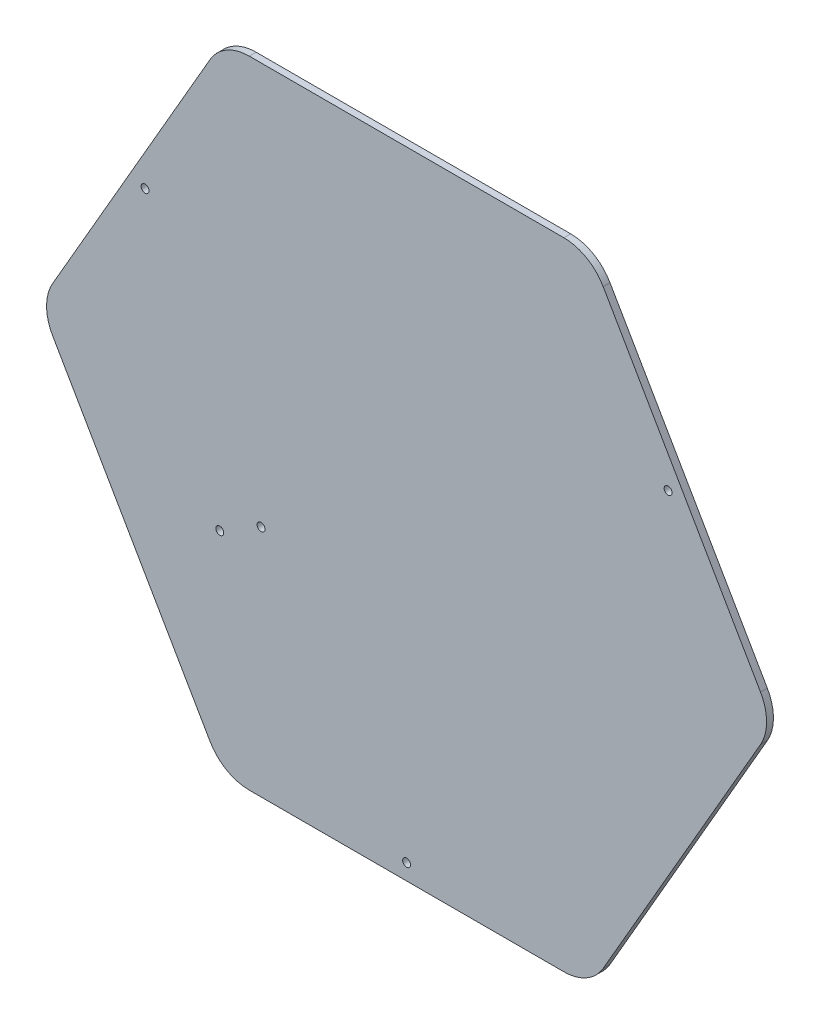
from build123d import *

# Parameters (mm, degrees)
SALIENTE_EXTRUIR1_DEPTH = 3
REDONDEO1_R             = 20
CROQUIS2_R              = 1.75
CORTAR_EXTRUIR1_DEPTH   = 212.545651301
CROQUIS3_R              = 1.75
CORTAR_EXTRUIR2_DEPTH   = 229.395238751


with BuildPart() as part:
    # Croquis1 → Saliente-Extruir1 (new body)
    with BuildSketch(Plane.XY):
        Polygon((-80.829037687, -140), (80.829037687, -140), (161.658075373, 0), (80.829037687, 140), (-80.829037687, 140), (-161.658075373, 0), align=None)
    extrude(amount=SALIENTE_EXTRUIR1_DEPTH)

    # Redondeo1
    redondeo1_edges = [part.edges().sort_by_distance(p)[0] for p in [
        (80.829037687, 140, 1.5),
        (-80.829037687, 140, 1.5),
        (-161.658075373, 0, 1.5),
        (-80.829037687, -140, 1.5),
        (80.829037687, -140, 1.5),
        (161.658075373, 0, 1.5),
    ]]
    fillet(redondeo1_edges, radius=REDONDEO1_R)

    # Croquis2 → Cortar-Extruir1 (cut, through all)
    with BuildSketch(Plane(origin=(0, 0, 0), x_dir=(1, 0, 0), z_dir=(0, 0, -1))):
        with Locations((0, 133)):
            Circle(CROQUIS2_R)
        with Locations((115.181378703, -66.5)):
            Circle(CROQUIS2_R)
        with Locations((-115.181378703, -66.5)):
            Circle(CROQUIS2_R)
    extrude(amount=-CORTAR_EXTRUIR1_DEPTH, mode=Mode.SUBTRACT)

    # Croquis3 → Cortar-Extruir2 (cut, through all)
    with BuildSketch(Plane.XY.offset(86.15)):
        with Locations((-64.09392774, -37.004646434)):
            Circle(CROQUIS3_R)
        with Locations((-82.280461219, -47.504646434)):
            Circle(CROQUIS3_R)
    extrude(amount=-CORTAR_EXTRUIR2_DEPTH, mode=Mode.SUBTRACT)


solid = part.part
